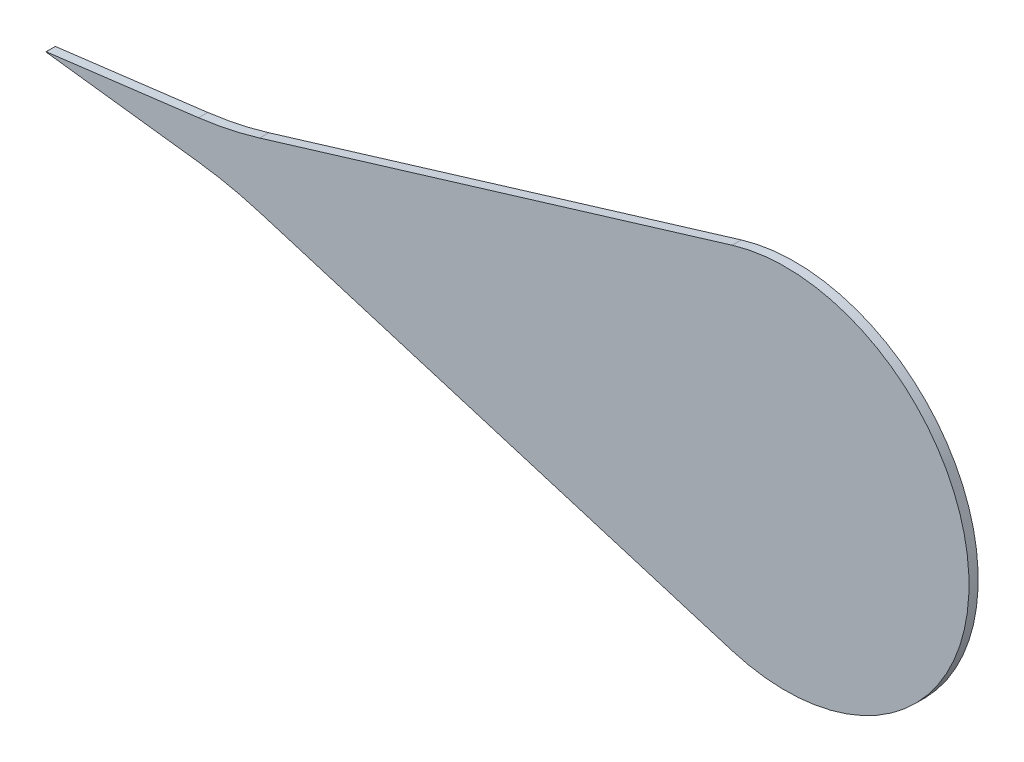
from build123d import *

# Parameters (mm, degrees)
EXTRUDE_2_DEPTH = 0.25


with BuildPart() as part:
    # 草圖1 → 填料-伸長2 (new body)
    with BuildSketch(Plane.XY):
        with BuildLine():
            Line((0.357380647, 0.004961492), (4.50941379, 0.523267787))
            ThreePointArc((4.50941379, 0.523267787), (5.349803134, 0.664770922), (6.175092484, 0.877314741))
            Line((6.175092484, 0.877314741), (19.047808057, 4.784468472))
            ThreePointArc((19.047808057, 4.784468472), (25.5, 0), (19.047808057, -4.784468472))
            Line((19.047808057, -4.784468472), (6.175092484, -0.877314741))
            ThreePointArc((6.175092484, -0.877314741), (5.349803134, -0.664770922), (4.50941379, -0.523267787))
            Line((4.50941379, -0.523267787), (0.357380647, -0.004961492))
            ThreePointArc((0.357380647, -0.004961492), (0.353, 0), (0.357380647, 0.004961492))
        make_face()
    extrude(amount=EXTRUDE_2_DEPTH)


solid = part.part
